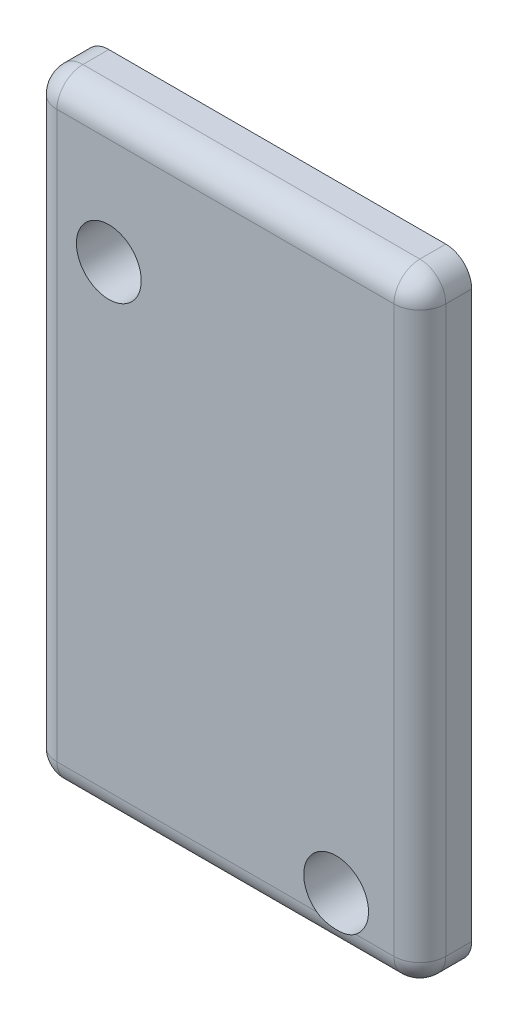
from build123d import *

# Parameters (mm, degrees)
SCHIZZO1_W                   = 15
SCHIZZO1_H                   = 23.8
SCHIZZO1_R                   = 1.25
ESTRUSIONE_ESTRUSIONE1_DEPTH = 2
RACCORDO1_R                  = 1
RACCORDO2_R                  = 1


with BuildPart() as part:
    # Schizzo1 → Estrusione-Estrusione1 (new body)
    with BuildSketch(Plane.XY):
        with Locations((-7.5, -11.9)):
            Rectangle(SCHIZZO1_W, SCHIZZO1_H)
        with Locations((-12, -5.1)):
            Circle(SCHIZZO1_R, mode=Mode.SUBTRACT)
        with Locations((-3.23, -21.8)):
            Circle(SCHIZZO1_R, mode=Mode.SUBTRACT)
    extrude(amount=ESTRUSIONE_ESTRUSIONE1_DEPTH)

    # Raccordo1
    raccordo1_edges = [part.edges().sort_by_distance(p)[0] for p in [
        (0, -23.8, 1),
        (-15, -23.8, 1),
        (-15, 0, 1),
        (0, 0, 1),
    ]]
    fillet(raccordo1_edges, radius=RACCORDO1_R)

    # Raccordo2
    # the kernel refuses this fillet: 1 mm, written as the material it takes off along each edge
    with BuildSketch(Plane(origin=(0, -22.8, 2), x_dir=(-1, 0, 0), z_dir=(0, 1, 0)), Plane(origin=(-15, -1, 2), x_dir=(1, 0, 0), z_dir=(0, -1, 0))) as raccordo2_piece_1:
        with BuildLine():
            CenterArc((RACCORDO2_R, -RACCORDO2_R), RACCORDO2_R, 90, 90)
            Line((0, -RACCORDO2_R), (0, 0))
            Line((0, 0), (RACCORDO2_R, 0))
        make_face()
    extrude(amount=21.8, mode=Mode.SUBTRACT)
    with BuildSketch(Plane(origin=(-14, -23.8, 2), x_dir=(0, 1, 0), z_dir=(1, 0, 0))) as raccordo2_piece_2:
        with BuildLine():
            CenterArc((RACCORDO2_R, -RACCORDO2_R), RACCORDO2_R, 90, 90)
            Line((0, -RACCORDO2_R), (0, 0))
            Line((0, 0), (RACCORDO2_R, 0))
        make_face()
    extrude(amount=13, mode=Mode.SUBTRACT)
    with BuildSketch(Plane(origin=(-1, 0, 2), x_dir=(0, 0, -1), z_dir=(-1, 0, 0))) as raccordo2_piece_3:
        with BuildLine():
            CenterArc((RACCORDO2_R, RACCORDO2_R), RACCORDO2_R, 180, 90)
            Line((0, RACCORDO2_R), (0, 0))
            Line((0, 0), (RACCORDO2_R, 0))
        make_face()
    extrude(amount=13, mode=Mode.SUBTRACT)
    with BuildSketch(Plane(origin=(-14, -22.8, 2), x_dir=(-1, 0, 0), z_dir=(0, 1, 0))) as raccordo2_piece_4:
        with BuildLine():
            CenterArc((1 - RACCORDO2_R, -RACCORDO2_R), RACCORDO2_R, 0, 90)
            Line((1, -RACCORDO2_R), (1, 0))
            Line((1, 0), (1 - RACCORDO2_R, 0))
        make_face()
    revolve(axis=Axis((-14, -22.8, 2), (0, 0, 1)), revolution_arc=90, mode=Mode.SUBTRACT)
    with BuildSketch(Plane(origin=(-14, -1, 2), x_dir=(0, 1, 0), z_dir=(1, 0, 0))) as raccordo2_piece_5:
        with BuildLine():
            CenterArc((1 - RACCORDO2_R, -RACCORDO2_R), RACCORDO2_R, 0, 90)
            Line((1 - RACCORDO2_R, 0), (1, 0))
            Line((1, 0), (1, -RACCORDO2_R))
        make_face()
    revolve(axis=Axis((-14, -1, 2), (0, 0, 1)), revolution_arc=90, mode=Mode.SUBTRACT)
    with BuildSketch(Plane(origin=(-1, -1, 2), x_dir=(0, 1, 0), z_dir=(-1, 0, 0))) as raccordo2_piece_6:
        with BuildLine():
            CenterArc((1 - RACCORDO2_R, RACCORDO2_R), RACCORDO2_R, 270, 90)
            Line((1 - RACCORDO2_R, 0), (1, 0))
            Line((1, 0), (1, RACCORDO2_R))
        make_face()
    revolve(axis=Axis((-1, -1, 2), (0, 0, -1)), revolution_arc=90, mode=Mode.SUBTRACT)
    with BuildSketch(Plane(origin=(-1, -22.8, 2), x_dir=(0, -1, 0), z_dir=(-1, 0, 0))) as raccordo2_piece_7:
        with BuildLine():
            CenterArc((1 - RACCORDO2_R, -RACCORDO2_R), RACCORDO2_R, 0, 90)
            Line((1, -RACCORDO2_R), (1, 0))
            Line((1, 0), (1 - RACCORDO2_R, 0))
        make_face()
    revolve(axis=Axis((-1, -22.8, 2), (0, 0, 1)), revolution_arc=90, mode=Mode.SUBTRACT)


solid = part.part
